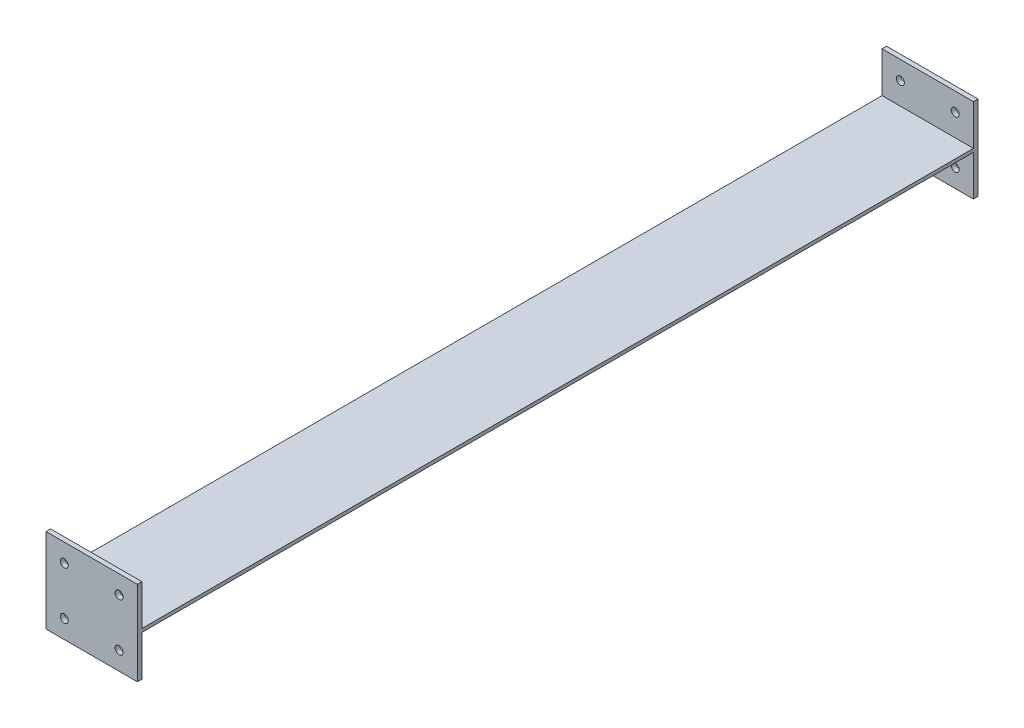
from build123d import *

# Parameters (mm, degrees)
SKETCH1_W           = 127
SKETCH1_H           = 117.348
BOSS_EXTRUDE1_DEPTH = 6.35
SKETCH2_W           = 127
SKETCH2_H           = 4.7625
BOSS_EXTRUDE2_DEPTH = 1155.7
SKETCH3_W           = 127
SKETCH3_H           = 117.348
BOSS_EXTRUDE3_DEPTH = 6.35
SKETCH4_R           = 5.55625
CUT_EXTRUDE1_DEPTH  = 1168.4


with BuildPart() as part:
    # Sketch1 → Boss-Extrude1 (new body)
    with BuildSketch(Plane.XY):
        with Locations((63.5, 58.674)):
            Rectangle(SKETCH1_W, SKETCH1_H)
    extrude(amount=-BOSS_EXTRUDE1_DEPTH)

    # Sketch2 → Boss-Extrude2 (add)
    with BuildSketch(Plane(origin=(0, 0, -6.35), x_dir=(-1, 0, 0), z_dir=(0, 0, -1))):
        with Locations((-63.5, 58.674)):
            Rectangle(SKETCH2_W, SKETCH2_H)
    extrude(amount=BOSS_EXTRUDE2_DEPTH)

    # Sketch3 → Boss-Extrude3 (add)
    with BuildSketch(Plane(origin=(0, 0, -1162.05), x_dir=(-1, 0, 0), z_dir=(0, 0, -1))):
        with Locations((-63.5, 58.674)):
            Rectangle(SKETCH3_W, SKETCH3_H)
    extrude(amount=BOSS_EXTRUDE3_DEPTH)

    # Sketch4 → Cut-Extrude1 (cut)
    with BuildSketch(Plane(origin=(0, 0, -1168.4), x_dir=(-1, 0, 0), z_dir=(0, 0, -1))):
        with Locations((-101.6, 91.948)):
            Circle(SKETCH4_R)
        with Locations((-25.4, 91.948)):
            Circle(SKETCH4_R)
        with Locations((-25.4, 25.4)):
            Circle(SKETCH4_R)
        with Locations((-101.6, 25.4)):
            Circle(SKETCH4_R)
    extrude(amount=-CUT_EXTRUDE1_DEPTH, mode=Mode.SUBTRACT)


solid = part.part
